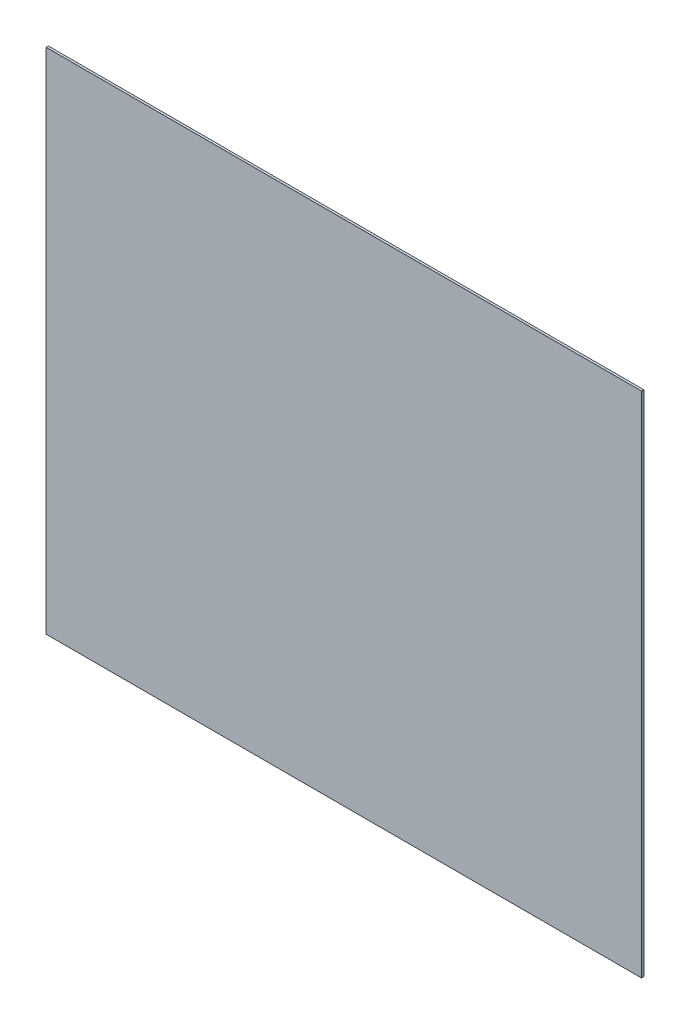
from build123d import *

# Parameters (mm, degrees)
SKETCH1_W           = 820
SKETCH1_H           = 700
BOSS_EXTRUDE1_DEPTH = 3.175


with BuildPart() as part:
    # Sketch1 → Boss-Extrude1 (new body)
    with BuildSketch(Plane.XY):
        Rectangle(SKETCH1_W, SKETCH1_H)
    extrude(amount=BOSS_EXTRUDE1_DEPTH)


solid = part.part
